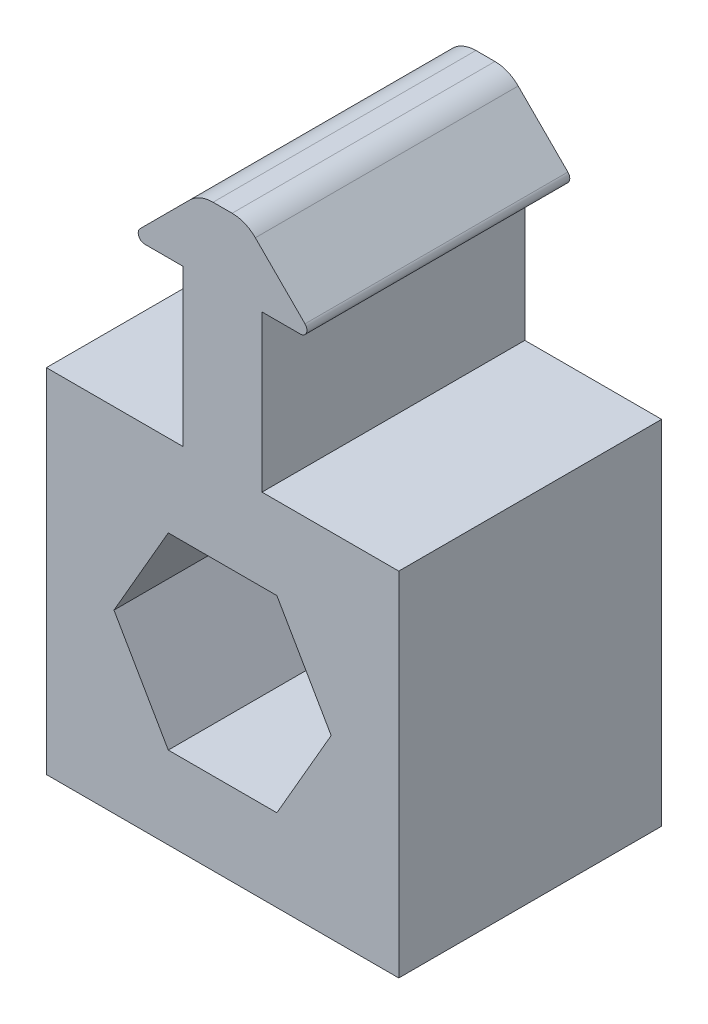
from build123d import *

# Parameters (mm, degrees)
BOSS_EXTRUDE1_DEPTH = 10.16


with BuildPart() as part:
    # Sketch1 → Boss-Extrude1 (new, symmetric)
    with BuildSketch(Plane.XY):
        with BuildLine():
            Line((-13.62075, 13.62075), (-13.62075, -13.62075))
            Line((-13.62075, -13.62075), (13.62075, -13.62075))
            Line((13.62075, -13.62075), (13.62075, 13.62075))
            Line((13.62075, 13.62075), (3.048, 13.62075))
            Line((3.048, 13.62075), (3.048, 25.68575))
            Line((3.048, 25.68575), (6.01257951, 25.68575))
            ThreePointArc((6.01257951, 25.68575), (6.481910313, 25.999346816), (6.371789755, 26.552960245))
            Line((6.371789755, 26.552960245), (2.532108776, 30.392641224))
            ThreePointArc((2.532108776, 30.392641224), (1.70807347, 30.943244013), (0.736057552, 31.13659))
            Line((0.736057552, 31.13659), (-0.736057552, 31.13659))
            ThreePointArc((-0.736057552, 31.13659), (-1.70807347, 30.943244013), (-2.532108776, 30.392641224))
            Line((-2.532108776, 30.392641224), (-6.371789755, 26.552960245))
            ThreePointArc((-6.371789755, 26.552960245), (-6.481910313, 25.999346816), (-6.01257951, 25.68575))
            Line((-6.01257951, 25.68575), (-3.048, 25.68575))
            Line((-3.048, 25.68575), (-3.048, 13.62075))
            Line((-3.048, 13.62075), (-13.62075, 13.62075))
        make_face()
        Polygon((-4.19776947, 7.27075), (-8.395538939, 0), (-4.19776947, -7.27075), (4.19776947, -7.27075), (8.395538939, 0), (4.19776947, 7.27075), align=None, mode=Mode.SUBTRACT)
    extrude(amount=BOSS_EXTRUDE1_DEPTH, both=True)


solid = part.part
